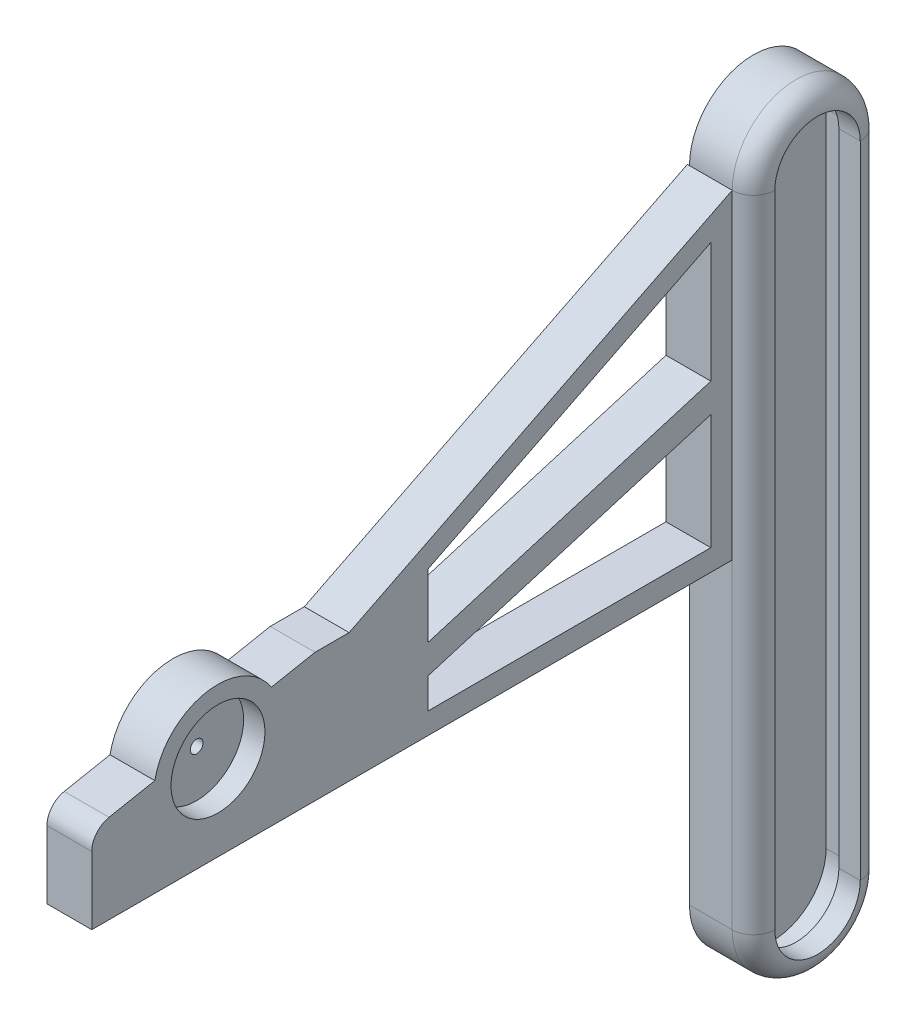
from build123d import *

# Parameters (mm, degrees)
BOSS_EXTRUDE3_DEPTH     = 10
BOSS_EXTRUDE4_DEPTH     = 30
CUT_EXTRUDE1_DEPTH      = 10
CUT_EXTRUDE1_DEPTH_BACK = 1
FILLET1_R               = 10
BOSS_EXTRUDE5_DEPTH     = 21
CUT_EXTRUDE2_DEPTH      = 21
FILLET2_R               = 10
SKETCH15_R              = 3
CUT_EXTRUDE3_DEPTH      = 21
SKETCH16_R              = 22
CUT_EXTRUDE4_DEPTH      = 10


with BuildPart() as part:
    # Sketch1 → Boss-Extrude3 (new body)
    with BuildSketch(Plane(origin=(0, 0, 0), x_dir=(0, 0, -1), z_dir=(1, 0, 0))):
        with BuildLine():
            Line((-20, 0), (-20, 300))
            ThreePointArc((-20, 300), (0, 320), (20, 300))
            Line((20, 300), (20, 0))
            ThreePointArc((20, 0), (0, -20), (-20, 0))
        make_face()
    extrude(amount=BOSS_EXTRUDE3_DEPTH)

    # Sketch1<5> → Boss-Extrude4 (add)
    with BuildSketch(Plane(origin=(0, 0, 0), x_dir=(0, 0, -1), z_dir=(1, 0, 0))):
        with BuildLine():
            Line((-30, 300), (-30, 0))
            ThreePointArc((-30, 0), (0, -30), (30, 0))
            Line((30, 0), (30, 300))
            ThreePointArc((30, 300), (0, 330), (-30, 300))
        make_face()
        with BuildLine():
            Line((-20, 0), (-20, 300))
            ThreePointArc((-20, 300), (0, 320), (20, 300))
            Line((20, 300), (20, 0))
            ThreePointArc((20, 0), (0, -20), (-20, 0))
        make_face(mode=Mode.SUBTRACT)
    extrude(amount=BOSS_EXTRUDE4_DEPTH)

    # Sketch2 → Cut-Extrude1 (cut, two sides: drawn at the far end of the back side and taken through both)
    with BuildSketch(Plane(origin=(10, 0, 0), x_dir=(0, 0, -1), z_dir=(1, 0, 0)).offset(-CUT_EXTRUDE1_DEPTH_BACK)):
        with BuildLine():
            Line((-25, 0), (-25, 300))
            ThreePointArc((-25, 300), (0, 325), (25, 300))
            Line((25, 300), (25, 0))
            ThreePointArc((25, 0), (0, -25), (-25, 0))
        make_face()
    extrude(amount=CUT_EXTRUDE1_DEPTH + CUT_EXTRUDE1_DEPTH_BACK, mode=Mode.SUBTRACT)

    # Fillet1
    fillet1_edges = [part.edges().sort_by_distance(p)[0] for p in [
        (30, 330, 0),
        (30, 150, 30),
        (30, -30, 0),
        (30, 150, -30),
    ]]
    fillet(fillet1_edges, radius=FILLET1_R - 0.0001)  # a hair under: the kernel refuses the full size

    # Sketch4 → Boss-Extrude5 (add)
    with BuildSketch(Plane.ZY.offset(-20)):
        with BuildLine():
            Line((30, 300), (30, 150))
            Line((30, 150), (330, 150))
            Line((330, 150), (330, 190))
            Line((330, 190), (300.476136934, 195.7258523))
            ThreePointArc((300.476136934, 195.7258523), (276.739397408, 219.4512428), (245.854526043, 206.319156964))
            Line((245.854526043, 206.319156964), (225.44540351, 210.277298245))
            Line((225.44540351, 210.277298245), (209.44540351, 210.277298245))
            Line((209.44540351, 210.277298245), (30, 300))
        make_face()
    extrude(amount=BOSS_EXTRUDE5_DEPTH)

    # Sketch6 → Cut-Extrude2 (cut)
    with BuildSketch(Plane(origin=(20, 0, 0), x_dir=(0, 0, -1), z_dir=(1, 0, 0))):
        Polygon((-40, 160), (-40, 213.989666216), (-172.534869505, 174.229205364), (-172.534869505, 160), align=None)
        Polygon((-40, 283.819660113), (-172.534869505, 217.55222536), (-172.534869505, 187.801603826), (-40, 227.562064677), align=None)
    extrude(amount=-CUT_EXTRUDE2_DEPTH, mode=Mode.SUBTRACT)

    # Fillet2
    fillet2_edges = [part.edges().sort_by_distance(p)[0] for p in [
        (9.5, 190, 330),
    ]]
    fillet(fillet2_edges, radius=FILLET2_R)

    # Sketch15 → Cut-Extrude3 (cut)
    with BuildSketch(Plane.ZY.offset(1)):
        with Locations((270.877121852, 189.785242032)):
            Circle(SKETCH15_R)
    extrude(amount=-CUT_EXTRUDE3_DEPTH, mode=Mode.SUBTRACT)

    # Sketch16 → Cut-Extrude4 (cut)
    with BuildSketch(Plane(origin=(20, 0, 0), x_dir=(0, 0, -1), z_dir=(1, 0, 0))):
        with Locations((-270.877121852, 189.785242032)):
            Circle(SKETCH16_R)
    extrude(amount=-CUT_EXTRUDE4_DEPTH, mode=Mode.SUBTRACT)


solid = part.part
